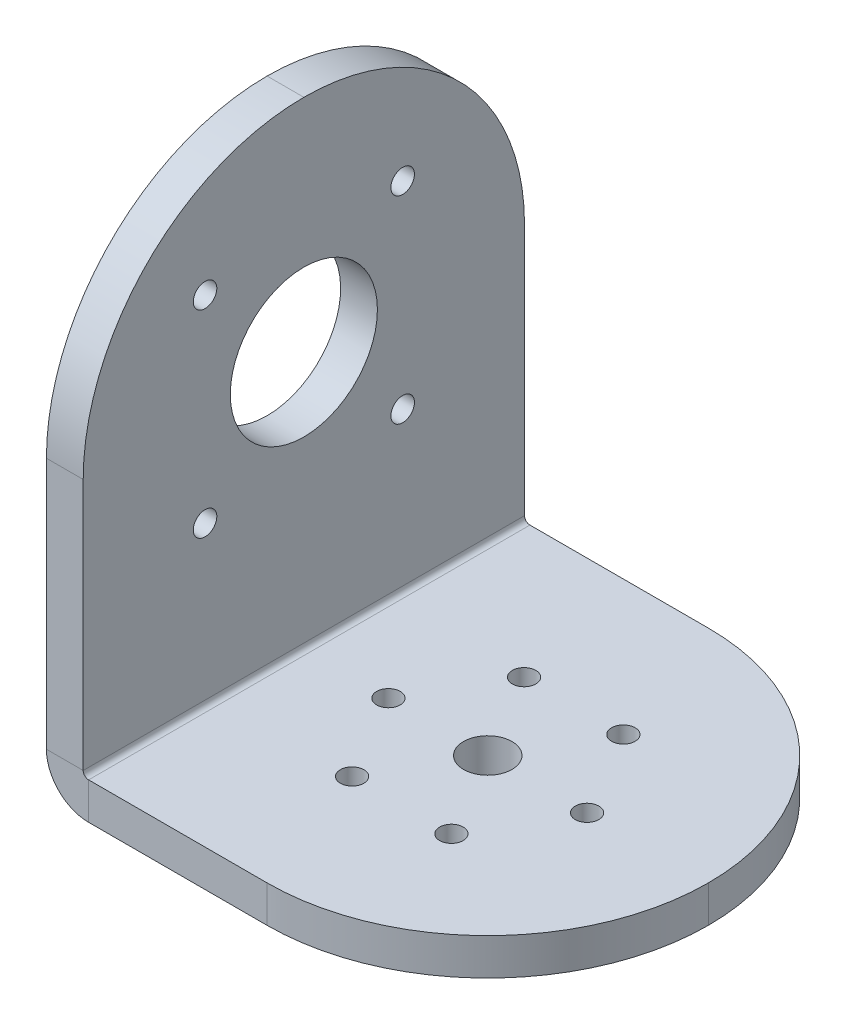
from build123d import *

# Parameters (mm, degrees)
SM_BASE_FLANGE_1_DEPTH  = 30
SKETCH_2_R              = 3.293373228
CUT_EXTRUDE_1_DEPTH     = 10
HOLE_WIZARD_1_OUTLINE_R = 1.6
HOLE_WIZARD_1_DEPTH     = 5
SKETCH_5_R              = 10
CUT_EXTRUDE_2_DEPTH     = 10
HOLE_WIZARD_2_OUTLINE_R = 1.6
HOLE_WIZARD_2_DEPTH     = 5
FILLET_1_R              = 30


# Read off the part's stored shape, not the designer's step: 孔1, 孔2
# Sheet-metal steps are written as plain solids
with BuildPart() as part:
    # Sketch 1 → 基体-法兰1 (new, symmetric)
    with BuildSketch(Plane.XY):
        with BuildLine():
            Line((60, 0), (5.7366, 0))
            ThreePointArc((5.7366, 0), (1.680211239, 1.680211239), (0, 5.7366))
            Line((0, 5.7366), (0, 70))
            Line((0, 70), (5, 70))
            Line((5, 70), (5, 5.7366))
            ThreePointArc((5, 5.7366), (5.215745145, 5.215745145), (5.7366, 5))
            Line((5.7366, 5), (60, 5))
            Line((60, 5), (60, 0))
        make_face()
    extrude(amount=SM_BASE_FLANGE_1_DEPTH, both=True)

    # Sketch 2 → 切除-拉伸1 (cut)
    with BuildSketch(Plane(origin=(0, 5, 0), x_dir=(1, 0, 0), z_dir=(0, 1, 0))):
        with Locations(Location((30, 0, 0), (0, 0, 180))):
            Circle(SKETCH_2_R)
    extrude(amount=-CUT_EXTRUDE_1_DEPTH, mode=Mode.SUBTRACT)

    # 孔1 outline → 孔1 (cut)
    with BuildSketch(Plane(origin=(0, 0, 0), x_dir=(1, 0, 0), z_dir=(0, 1, 0))):
        with Locations((23.25, -11.691342951)):
            Circle(HOLE_WIZARD_1_OUTLINE_R)
        with Locations((16.5, 0)):
            Circle(HOLE_WIZARD_1_OUTLINE_R)
        with Locations((23.25, 11.691342951)):
            Circle(HOLE_WIZARD_1_OUTLINE_R)
        with Locations((36.75, 11.691342951)):
            Circle(HOLE_WIZARD_1_OUTLINE_R)
        with Locations((43.5, 0)):
            Circle(HOLE_WIZARD_1_OUTLINE_R)
        with Locations((36.75, -11.691342951)):
            Circle(HOLE_WIZARD_1_OUTLINE_R)
    extrude(amount=HOLE_WIZARD_1_DEPTH, mode=Mode.SUBTRACT)

    # 草图5 → 切除-拉伸2 (cut)
    with BuildSketch(Plane.ZY):
        with Locations(Location((0, 40, 0), (0, 0, 270))):
            Circle(SKETCH_5_R)
    extrude(amount=-CUT_EXTRUDE_2_DEPTH, mode=Mode.SUBTRACT)

    # 孔2 outline → 孔2 (cut)
    with BuildSketch(Plane.YZ):
        with Locations((26.564971157, 13.435028843)):
            Circle(HOLE_WIZARD_2_OUTLINE_R)
        with Locations((26.564971157, -13.435028843)):
            Circle(HOLE_WIZARD_2_OUTLINE_R)
        with Locations((53.435028843, -13.435028843)):
            Circle(HOLE_WIZARD_2_OUTLINE_R)
        with Locations((53.435028843, 13.435028843)):
            Circle(HOLE_WIZARD_2_OUTLINE_R)
    extrude(amount=HOLE_WIZARD_2_DEPTH, mode=Mode.SUBTRACT)

    # 圆角1
    fillet_1_edges = [part.edges().sort_by_distance(p)[0] for p in [
        (60, 2.5, -30),
        (60, 2.5, 30),
        (2.5, 70, -30),
        (2.5, 70, 30),
    ]]
    fillet(fillet_1_edges, radius=FILLET_1_R - 0.0001)  # a hair under: the kernel refuses the full size


solid = part.part
